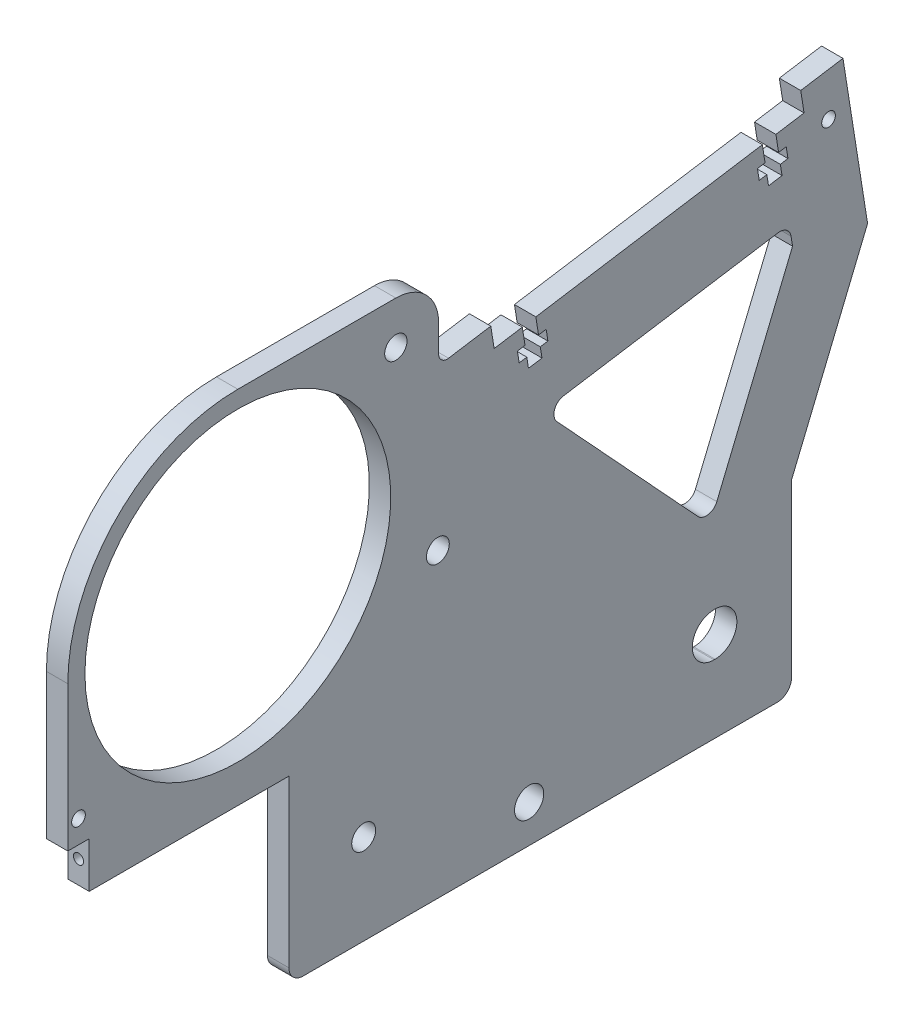
from build123d import *

# Parameters (mm, degrees)
SKETCH1_R           = 1.524
SKETCH1_R_2         = 2.667
SKETCH1_R_3         = 34.04
SKETCH1_R_4         = 3.2512
SKETCH1_R_5         = 2.54
SKETCH1_R_6         = 2.4892
BOSS_EXTRUDE1_DEPTH = 4.7625
SKETCH2_R           = 1.1303
CUT_EXTRUDE1_DEPTH  = 6.35


with BuildPart() as part:
    # Sketch1 → Boss-Extrude1 (new body)
    with BuildSketch(Plane(origin=(0, 0, 0), x_dir=(0, 0, -1), z_dir=(1, 0, 0))):
        with BuildLine():
            Line((-28.170295117, 0), (77.382795117, 0))
            ThreePointArc((77.382795117, 0), (79.627859148, 0.92993597), (80.557795117, 3.175))
            Line((80.557795117, 3.175), (80.557795117, 38.504743526))
            Line((80.557795117, 38.504743526), (80.557795117, 41.307035595))
            Line((80.557795117, 41.307035595), (97.47645297, 82.259613252))
            Line((97.47645297, 82.259613252), (92.000706017, 116.832118869))
            Line((92.000706017, 116.832118869), (82.592974573, 115.342080589))
            Line((82.592974573, 115.342080589), (83.337993713, 110.638214867))
            Line((83.337993713, 110.638214867), (77.06617275, 109.644856014))
            Line((77.06617275, 109.644856014), (77.667154856, 105.850404332))
            Line((77.667154856, 105.850404332), (79.360546516, 106.118611222))
            Line((79.360546516, 106.118611222), (79.752923263, 103.641241942))
            Line((79.752923263, 103.641241942), (78.059531603, 103.373035051))
            Line((78.059531603, 103.373035051), (78.432041173, 101.02110219))
            Line((78.432041173, 101.02110219), (75.421567111, 100.544289941))
            Line((75.421567111, 100.544289941), (75.049057541, 102.896222802))
            Line((75.049057541, 102.896222802), (73.355665881, 102.628015911))
            Line((73.355665881, 102.628015911), (72.963289134, 105.105385192))
            Line((72.963289134, 105.105385192), (74.656680794, 105.373592082))
            Line((74.656680794, 105.373592082), (74.055698688, 109.168043765))
            Line((74.055698688, 109.168043765), (23.630258147, 101.181438586))
            Line((23.630258147, 101.181438586), (24.231240253, 97.386986904))
            Line((24.231240253, 97.386986904), (25.924631913, 97.655193794))
            Line((25.924631913, 97.655193794), (26.31700866, 95.177824514))
            Line((26.31700866, 95.177824514), (24.623617, 94.909617624))
            Line((24.623617, 94.909617624), (24.99612657, 92.557684763))
            Line((24.99612657, 92.557684763), (21.985652508, 92.080872513))
            Line((21.985652508, 92.080872513), (21.613142938, 94.432805374))
            Line((21.613142938, 94.432805374), (19.919751278, 94.164598484))
            Line((19.919751278, 94.164598484), (19.527374531, 96.641967764))
            Line((19.527374531, 96.641967764), (21.220766191, 96.910174654))
            Line((21.220766191, 96.910174654), (20.619784085, 100.704626337))
            Line((20.619784085, 100.704626337), (14.347963122, 99.711267484))
            Line((14.347963122, 99.711267484), (13.602943983, 104.415133206))
            Line((13.602943983, 104.415133206), (4.195212538, 102.925094927))
            ThreePointArc((4.195212538, 102.925094927), (2.66000635, 103.358067851), (1.992204883, 104.806641215))
            Line((1.992204883, 104.806641215), (1.992204883, 110.875))
            ThreePointArc((1.992204883, 110.875), (-0.797603027, 117.610192091), (-7.532795117, 120.4))
            Line((-7.532795117, 120.4), (-42.707795117, 120.4))
            ThreePointArc((-42.707795117, 120.4), (-69.471786785, 109.313991668), (-80.557795117, 82.55))
            Line((-80.557795117, 82.55), (-80.557795117, 50.292))
            Line((-80.557795117, 50.292), (-75.795295117, 50.292))
            Line((-75.795295117, 50.292), (-75.795295117, 40.132))
            Line((-75.795295117, 40.132), (-31.345295117, 40.132))
            Line((-31.345295117, 40.132), (-31.345295117, 3.175))
            ThreePointArc((-31.345295117, 3.175), (-30.415359148, 0.92993597), (-28.170295117, 0))
        make_face()
        with Locations((-78.176545117, 55.372)):
            Circle(SKETCH1_R, mode=Mode.SUBTRACT)
        with Locations((-14.692204883, 20.066)):
            Circle(SKETCH1_R_2, mode=Mode.SUBTRACT)
        with Locations((-42.707795117, 82.55)):
            Circle(SKETCH1_R_3, mode=Mode.SUBTRACT)
        with Locations((22.137795117, 8.382)):
            Circle(SKETCH1_R_4, mode=Mode.SUBTRACT)
        with Locations((1.817795117, 67.06)):
            Circle(SKETCH1_R_5, mode=Mode.SUBTRACT)
        with Locations((88.786878575, 106.679368285)):
            Circle(SKETCH1_R, mode=Mode.SUBTRACT)
        with Locations((-7.532795117, 110.875)):
            Circle(SKETCH1_R_6, mode=Mode.SUBTRACT)
        with BuildLine():
            Line((63.539795117, 15.2273), (63.285795117, 15.2273))
            ThreePointArc((63.285795117, 15.2273), (58.447095117, 20.066), (63.285795117, 24.9047))
            Line((63.285795117, 24.9047), (63.539795117, 24.9047))
            ThreePointArc((63.539795117, 24.9047), (68.378495117, 20.066), (63.539795117, 15.2273))
        make_face(mode=Mode.SUBTRACT)
        with BuildLine():
            Line((77.537520924, 90.432049584), (29.798497, 82.870930999))
            ThreePointArc((29.798497, 82.870930999), (27.796275371, 81.195081352), (28.32965855, 78.639134195))
            Line((28.32965855, 78.639134195), (59.69934146, 44.663967177))
            ThreePointArc((59.69934146, 44.663967177), (62.012477448, 43.886669197), (63.913077429, 45.417195238))
            Line((63.913077429, 45.417195238), (80.774519188, 86.231278073))
            Line((80.774519188, 86.231278073), (80.44359285, 88.320664741))
            ThreePointArc((80.44359285, 88.320664741), (79.427839006, 89.978224365), (77.537520924, 90.432049584))
        make_face(mode=Mode.SUBTRACT)
    extrude(amount=BOSS_EXTRUDE1_DEPTH)

    # Sketch2 → Cut-Extrude1 (cut)
    with BuildSketch(Plane.XY.offset(75.795295117)):
        with Locations((2.38125, 45.212)):
            Circle(SKETCH2_R)
    extrude(amount=-CUT_EXTRUDE1_DEPTH, mode=Mode.SUBTRACT)


solid = part.part
